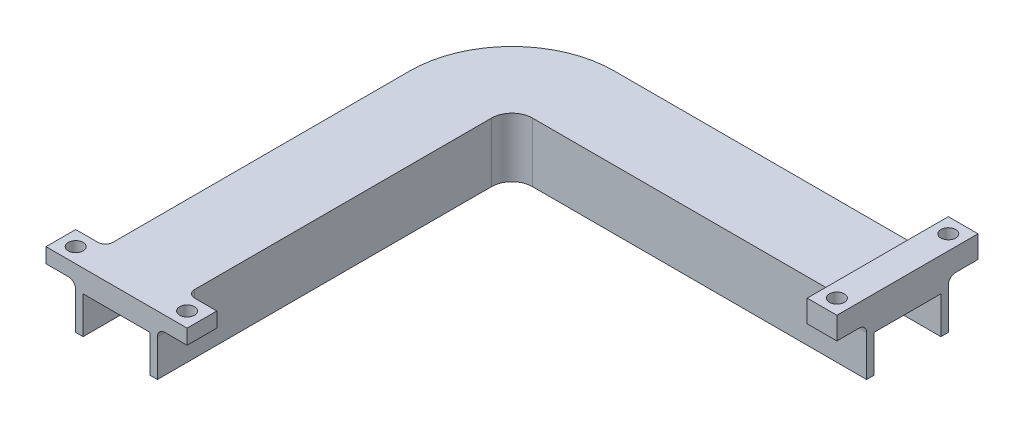
from build123d import *

# Parameters (mm, degrees)
SKETCH1_W           = 90
SKETCH1_H           = 22
BOSS_EXTRUDE1_DEPTH = 16
SKETCH2_W           = 119.5
SKETCH2_H           = 18
CUT_EXTRUDE1_DEPTH  = 10
SWEEP5_START        = 10
SWEEP5_DEPTH        = 6
SWEEP5_2_DEPTH      = 10
BOSS_EXTRUDE2_DEPTH = 90
SKETCH12_W          = 8
SKETCH12_H          = 11
SKETCH12_H_2        = 8
SKETCH12_R          = 2
BOSS_EXTRUDE3_DEPTH = 3
SKETCH14_W          = 8
SKETCH14_H          = 8
SKETCH14_R          = 2
SKETCH14_W_2        = 11
BOSS_EXTRUDE4_DEPTH = 4
FILLET1_R           = 2


# Read off the part's stored shape, not the designer's step: Sweep5
with BuildPart() as part:
    # Sketch1 → Boss-Extrude1 (new body)
    with BuildSketch(Plane(origin=(0, 0, 0), x_dir=(1, 0, 0), z_dir=(0, 1, 0))):
        Rectangle(SKETCH1_W, SKETCH1_H)
    extrude(amount=BOSS_EXTRUDE1_DEPTH)

    # Sketch2 → Cut-Extrude1 (cut)
    with BuildSketch(Plane.XZ):
        Rectangle(SKETCH2_W, SKETCH2_H)
    extrude(amount=-CUT_EXTRUDE1_DEPTH, mode=Mode.SUBTRACT)

    # Sweep5 outline → Sweep5 (add)
    with BuildSketch(Plane(origin=(0, 0, 0), x_dir=(1, 0, 0), z_dir=(0, 1, 0)).offset(SWEEP5_START)):
        with BuildLine():
            ThreePointArc((-45, 11), (-64.445436483, 2.945436483), (-72.5, -16.5))
            Line((-72.5, -16.5), (-50.5, -16.5))
            ThreePointArc((-50.5, -16.5), (-48.889087297, -12.610912703), (-45, -11))
            Line((-45, -11), (-45, 11))
        make_face()
    extrude(amount=SWEEP5_DEPTH)

    # Sweep5 2 outline → Sweep5 2 (add)
    with BuildSketch(Plane(origin=(0, 0, 0), x_dir=(1, 0, 0), z_dir=(0, 1, 0))):
        with BuildLine():
            ThreePointArc((-45, 11), (-64.445436483, 2.945436483), (-72.5, -16.5))
            Line((-72.5, -16.5), (-70.5, -16.5))
            ThreePointArc((-70.5, -16.5), (-63.03122292, 1.53122292), (-45, 9))
            Line((-45, 9), (-45, 11))
        make_face()
        with BuildLine():
            ThreePointArc((-45, -9), (-50.303300859, -11.196699141), (-52.5, -16.5))
            Line((-52.5, -16.5), (-50.5, -16.5))
            ThreePointArc((-50.5, -16.5), (-48.889087297, -12.610912703), (-45, -11))
            Line((-45, -11), (-45, -9))
        make_face()
    extrude(amount=SWEEP5_2_DEPTH)

    # Sketch11 → Boss-Extrude2 (add)
    with BuildSketch(Plane.XY.offset(16.5)):
        Polygon((-72.5, 16), (-72.5, 0), (-70.5, 0), (-70.5, 10), (-52.5, 10), (-52.5, 0), (-50.5, 0), (-50.5, 16), align=None)
    extrude(amount=BOSS_EXTRUDE2_DEPTH)

    # Sketch12 → Boss-Extrude3 (add, symmetric)
    # profile 1 of 4: a face of its own
    with BuildSketch(Plane(origin=(0, 16, 0), x_dir=(1, 0, 0), z_dir=(0, 1, 0))):
        with Locations((41, 5.5)):
            Rectangle(SKETCH12_W, SKETCH12_H)
    # profile 2 of 4: a face of its own
    with BuildSketch(Plane(origin=(0, 16, 0), x_dir=(1, 0, 0), z_dir=(0, 1, 0))):
        with Locations((41, -5.5)):
            Rectangle(SKETCH12_W, SKETCH12_H)
    # profile 3 of 4: a face of its own
    with BuildSketch(Plane(origin=(0, 16, 0), x_dir=(1, 0, 0), z_dir=(0, 1, 0))):
        with Locations((41, -15)):
            Rectangle(SKETCH12_W, SKETCH12_H_2)
        with Locations(Location((41, -15, 0), (0, 0, 270))):
            Circle(SKETCH12_R, mode=Mode.SUBTRACT)
    # profile 4 of 4: a face of its own
    with BuildSketch(Plane(origin=(0, 16, 0), x_dir=(1, 0, 0), z_dir=(0, 1, 0))):
        with Locations((41, 15)):
            Rectangle(SKETCH12_W, SKETCH12_H_2)
        with Locations(Location((41, 15, 0), (0, 0, 270))):
            Circle(SKETCH12_R, mode=Mode.SUBTRACT)
    extrude(amount=BOSS_EXTRUDE3_DEPTH, both=True)

    # Sketch14 → Boss-Extrude4 (add)
    # profile 1 of 4: a face of its own
    with BuildSketch(Plane(origin=(0, 16, 0), x_dir=(1, 0, 0), z_dir=(0, 1, 0))):
        with Locations((-76.5, -102.5)):
            Rectangle(SKETCH14_W, SKETCH14_H)
        with Locations(Location((-76.5, -102.5, 0), (0, 0, 270))):
            Circle(SKETCH14_R, mode=Mode.SUBTRACT)
    # profile 2 of 4: a face of its own
    with BuildSketch(Plane(origin=(0, 16, 0), x_dir=(1, 0, 0), z_dir=(0, 1, 0))):
        with Locations((-67, -102.5)):
            Rectangle(SKETCH14_W_2, SKETCH14_H)
    # profile 3 of 4: a face of its own
    with BuildSketch(Plane(origin=(0, 16, 0), x_dir=(1, 0, 0), z_dir=(0, 1, 0))):
        with Locations((-56, -102.5)):
            Rectangle(SKETCH14_W_2, SKETCH14_H)
    # profile 4 of 4: a face of its own
    with BuildSketch(Plane(origin=(0, 16, 0), x_dir=(1, 0, 0), z_dir=(0, 1, 0))):
        with Locations((-46.5, -102.5)):
            Rectangle(SKETCH14_W, SKETCH14_H)
        with Locations(Location((-46.5, -102.5, 0), (0, 0, 270))):
            Circle(SKETCH14_R, mode=Mode.SUBTRACT)
    extrude(amount=-BOSS_EXTRUDE4_DEPTH)

    # Fillet1
    fillet1_edges = [part.edges().sort_by_distance(p)[0] for p in [
        (-50.5, 14, 98.5),
        (-72.5, 12, 102.5),
        (-50.5, 12, 102.5),
        (-72.5, 14, 98.5),
        (37, 16, 0),
        (41, 13, 11),
        (41, 13, -11),
        (37, 14.5, -11),
        (37, 14.5, 11),
    ]]
    fillet(fillet1_edges, radius=FILLET1_R - 0.0001)  # a hair under: the kernel refuses the full size


solid = part.part
